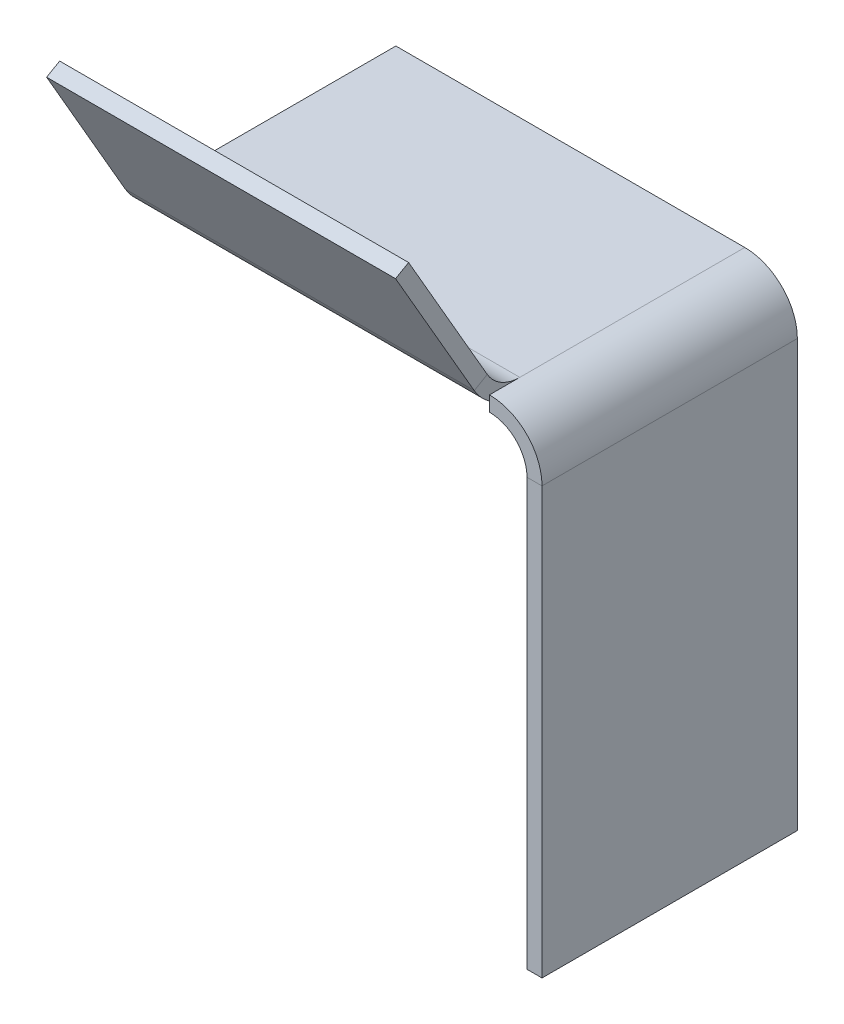
from build123d import *

# Parameters (mm, degrees)
BASE_FLANGE1_DEPTH   = 34
EDGE_FLANGE1_START   = -53.462169132
EDGE_FLANGE1_DEPTH   = 46.462169132
EDGE_FLANGE1_2_DEPTH = 46.462169132


# Read off the part's stored shape, not the designer's step: Edge-Flange1
# Sheet-metal steps are written as plain solids
with BuildPart() as part:
    # Sketch1 → Base-Flange1 (new body)
    with BuildSketch(Plane.XY):
        with BuildLine():
            Line((0, 0), (0, 56.743355504))
            ThreePointArc((0, 56.743355504), (-2.050252532, 61.693102972), (-7, 63.743355504))
            Line((-7, 63.743355504), (-53.462169132, 63.743355504))
            Line((-53.462169132, 63.743355504), (-53.462169132, 61.743355504))
            Line((-53.462169132, 61.743355504), (-7, 61.743355504))
            ThreePointArc((-7, 61.743355504), (-3.464466094, 60.278889409), (-2, 56.743355504))
            Line((-2, 56.743355504), (-2, 0))
            Line((-2, 0), (0, 0))
        make_face()
    extrude(amount=BASE_FLANGE1_DEPTH)

    # Edge-Flange1 outline → Edge-Flange1 (cut)
    with BuildSketch(Plane.YZ.offset(EDGE_FLANGE1_START)):
        with BuildLine():
            ThreePointArc((61.743355504, 29.958548116), (62.072211206, 32.078886242), (63.027879437, 34))
            Line((63.027879437, 34), (61.743355504, 34))
            Line((61.743355504, 34), (61.743355504, 29.958548116))
        make_face()
    extrude(amount=EDGE_FLANGE1_DEPTH, mode=Mode.SUBTRACT)

    # Edge-Flange1 2 outline → Edge-Flange1 2 (add)
    with BuildSketch(Plane.YZ.offset(EDGE_FLANGE1_START)):
        with BuildLine():
            Line((83.393990598, 46.5), (65.243355504, 36.020725942))
            ThreePointArc((65.243355504, 36.020725942), (64.026144133, 35.130386946), (63.027879437, 34))
            Line((63.027879437, 34), (63.743355504, 34))
            Line((63.743355504, 34), (63.743355504, 29.958548116))
            ThreePointArc((63.743355504, 29.958548116), (64.413228485, 32.458548116), (66.243355504, 34.288675135))
            Line((66.243355504, 34.288675135), (84.393990598, 44.767949192))
            Line((84.393990598, 44.767949192), (83.393990598, 46.5))
        make_face()
    extrude(amount=EDGE_FLANGE1_2_DEPTH)


solid = part.part
